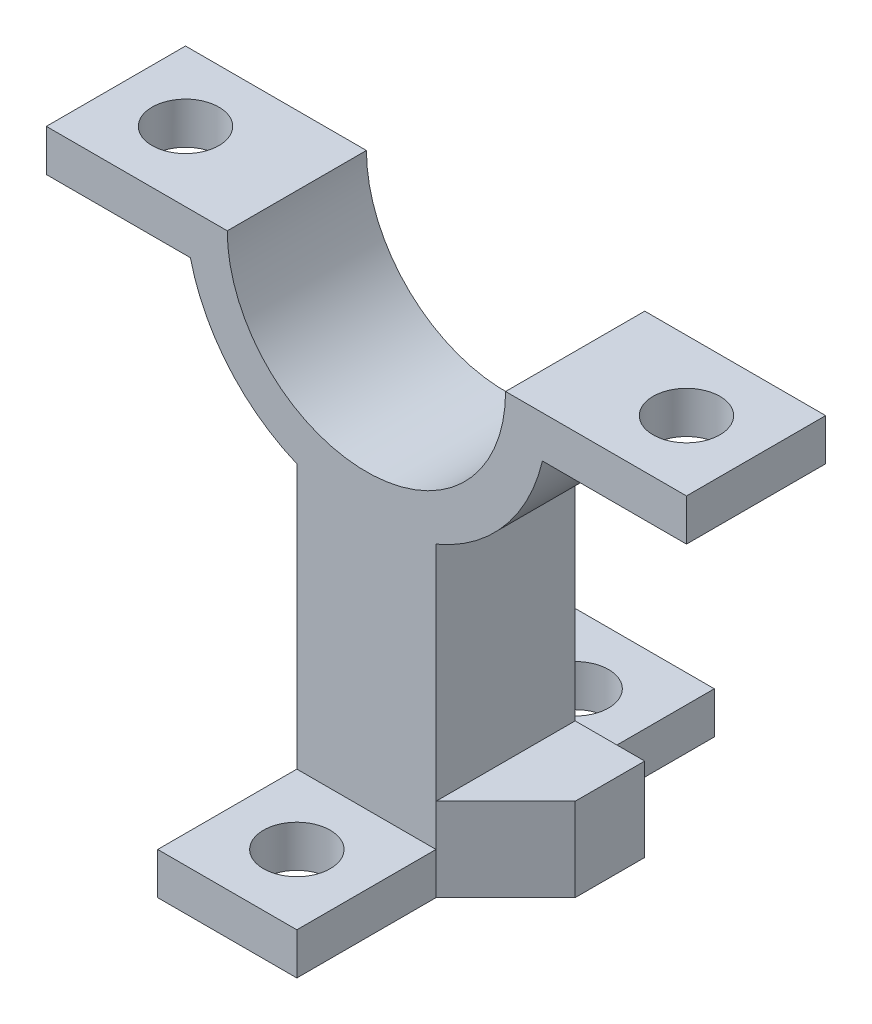
from build123d import *

# Parameters (mm, degrees)
BOSS_EXTRUDE1_DEPTH     = 2.5
SKETCH2_R               = 1.2
CUT_EXTRUDE1_DEPTH      = 21.676073128
SKETCH3_W               = 5
SKETCH3_H               = 15
SKETCH3_R               = 1.2
BOSS_EXTRUDE2_DEPTH     = 1.5
CUT_EXTRUDE2_REACH      = 23.852
CUT_EXTRUDE2_END_RADIUS = 6.5
CUT_EXTRUDE4_START      = -2.5
CUT_EXTRUDE4_DEPTH      = 5


# Read off the part's stored shape, not the designer's step: Cut-Extrude4
with BuildPart() as part:
    # Sketch1 → Boss-Extrude1 (new, symmetric)
    with BuildSketch(Plane.XY):
        with BuildLine():
            Line((5, 0), (11.5, 0))
            Line((11.5, 0), (11.5, -1.5))
            Line((11.5, -1.5), (6.32455532, -1.5))
            ThreePointArc((6.32455532, -1.5), (5.81561728, -2.903204376), (5, -4.153311931))
            Line((5, -4.153311931), (5, -17))
            Line((5, -17), (-5, -17))
            Line((-5, -17), (-5, -4.153311931))
            ThreePointArc((-5, -4.153311931), (-5.81561728, -2.903204376), (-6.32455532, -1.5))
            Line((-6.32455532, -1.5), (-11.5, -1.5))
            Line((-11.5, -1.5), (-11.5, 0))
            Line((-11.5, 0), (-5, 0))
            ThreePointArc((-5, 0), (0, -5), (5, 0))
        make_face()
    extrude(amount=BOSS_EXTRUDE1_DEPTH, both=True)

    # Sketch2 → Cut-Extrude1 (cut, through all)
    with BuildSketch(Plane(origin=(0, 0, 0), x_dir=(1, 0, 0), z_dir=(0, 1, 0))):
        with Locations(Location((-9, 0, 0), (0, 0, 270))):
            Circle(SKETCH2_R)
        with Locations(Location((9, 0, 0), (0, 0, 180))):
            Circle(SKETCH2_R)
    extrude(amount=-CUT_EXTRUDE1_DEPTH, mode=Mode.SUBTRACT)

    # Sketch3 → Boss-Extrude2 (add)
    with BuildSketch(Plane.XZ.offset(17)):
        Rectangle(SKETCH3_W, SKETCH3_H)
        with Locations((0, 5)):
            Circle(SKETCH3_R, mode=Mode.SUBTRACT)
        with Locations(Location((0, -5, 0), (0, 0, 180))):
            Circle(SKETCH3_R, mode=Mode.SUBTRACT)
    extrude(amount=-BOSS_EXTRUDE2_DEPTH)

    # Cut-Extrude2: up to this cylinder (the profile starts outside it)
    cut_extrude2_end = Plane(origin=(0, 0, 1.666667), z_dir=(0, 0, -1)) * Cylinder(CUT_EXTRUDE2_END_RADIUS, 61.704, mode=Mode.PRIVATE)
    # Sketch4 → Cut-Extrude2 (cut, up to the surface)
    with BuildSketch(Plane.XZ.offset(17), mode=Mode.PRIVATE) as cut_extrude2_sk1:
        Polygon((2.5, 2.5), (5, 0), (5, 2.5), align=None)
    cut_extrude2_tool1 = extrude(cut_extrude2_sk1.sketch, amount=-CUT_EXTRUDE2_REACH, mode=Mode.PRIVATE) - cut_extrude2_end
    add(cut_extrude2_tool1.solids().sort_by_distance((4.166667, -17, 1.666667))[0], mode=Mode.SUBTRACT)
    # Sketch4 → Cut-Extrude2 (cut, up to the surface)
    with BuildSketch(Plane.XZ.offset(17), mode=Mode.PRIVATE) as cut_extrude2_sk2:
        Polygon((-5, 2.5), (-2.5, 2.5), (-5, 0), align=None)
    cut_extrude2_tool2 = extrude(cut_extrude2_sk2.sketch, amount=-CUT_EXTRUDE2_REACH, mode=Mode.PRIVATE) - cut_extrude2_end
    add(cut_extrude2_tool2.solids().sort_by_distance((-4.166667, -17, 1.666667))[0], mode=Mode.SUBTRACT)

    # Cut-Extrude4 outline → Cut-Extrude4 (cut)
    with BuildSketch(Plane.XY.offset(CUT_EXTRUDE4_START)):
        with BuildLine():
            Line((-2.5, -14), (-2.5, -6))
            ThreePointArc((-2.5, -6), (-3.862002616, -5.228282299), (-5, -4.153311931))
            Line((-5, -4.153311931), (-5, -14))
            Line((-5, -14), (-2.5, -14))
        make_face()
        with BuildLine():
            Line((5, -14), (5, -4.153311931))
            ThreePointArc((5, -4.153311931), (3.862002616, -5.228282299), (2.5, -6))
            Line((2.5, -6), (2.5, -14))
            Line((2.5, -14), (5, -14))
        make_face()
    extrude(amount=CUT_EXTRUDE4_DEPTH, mode=Mode.SUBTRACT)


solid = part.part
